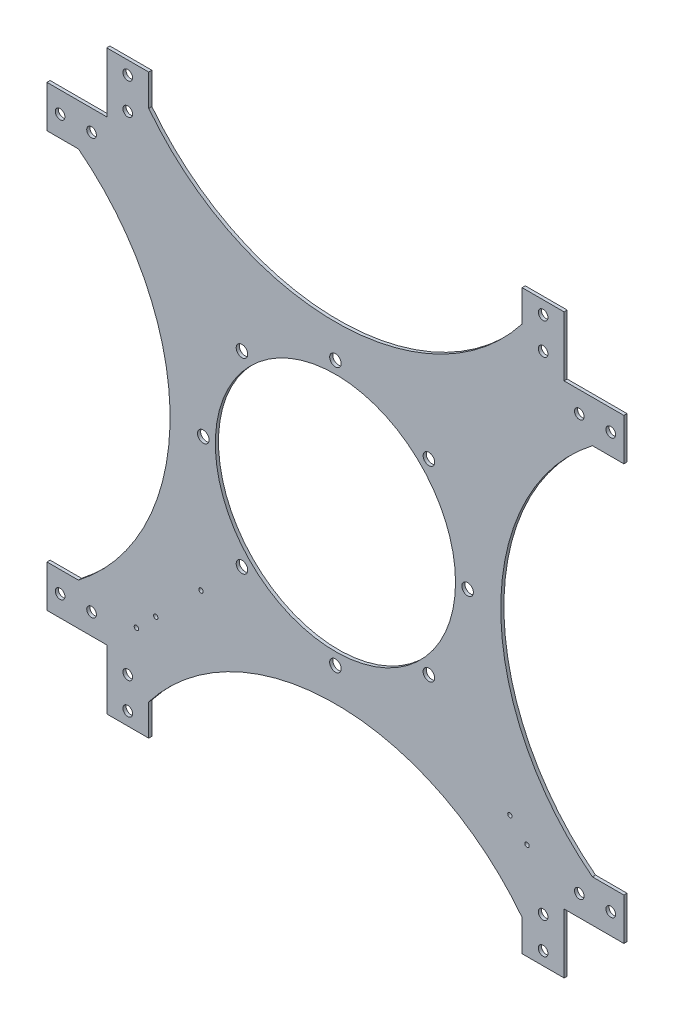
from build123d import *

# Parameters (mm, degrees)
SKETCH1_R          = 114.5
BASE_FLANGE1_DEPTH = 3
SKETCH2_R          = 4.6
EXTRUDE1_DEPTH     = 3
SKETCH3_R          = 5.5
EXTRUDE2_DEPTH     = 3
CIRPATTERN1_COUNT  = 8
SKETCH4_R          = 2.1
CUT_EXTRUDE1_DEPTH = 10


# Sheet-metal steps are written as plain solids
with BuildPart() as part:
    # Sketch1 → Base-Flange1 (new body)
    with BuildSketch(Plane.XY):
        with BuildLine():
            Line((218, 218), (218, 275))
            Line((218, 275), (178, 275))
            Line((178, 275), (178, 245))
            ThreePointArc((178, 245), (0, 157.626305625), (-178, 245))
            Line((-178, 245), (-178, 275))
            Line((-178, 275), (-218, 275))
            Line((-218, 275), (-218, 218))
            Line((-218, 218), (-275, 218))
            Line((-275, 218), (-275, 178))
            Line((-275, 178), (-245, 178))
            ThreePointArc((-245, 178), (-157.626305625, 0), (-245, -178))
            Line((-245, -178), (-275, -178))
            Line((-275, -178), (-275, -218))
            Line((-275, -218), (-218, -218))
            Line((-218, -218), (-218, -275))
            Line((-218, -275), (-178, -275))
            Line((-178, -275), (-178, -245))
            ThreePointArc((-178, -245), (0, -157.626305625), (178, -245))
            Line((178, -245), (178, -275))
            Line((178, -275), (218, -275))
            Line((218, -275), (218, -218))
            Line((218, -218), (275, -218))
            Line((275, -218), (275, -178))
            Line((275, -178), (245, -178))
            ThreePointArc((245, -178), (157.626305625, 0), (245, 178))
            Line((245, 178), (275, 178))
            Line((275, 178), (275, 218))
            Line((275, 218), (218, 218))
        make_face()
        Circle(SKETCH1_R, mode=Mode.SUBTRACT)
    extrude(amount=BASE_FLANGE1_DEPTH)

    # Sketch2 → Extrude1 (cut)
    with BuildSketch(Plane.XY.offset(3)):
        with Locations((198, 262.5)):
            Circle(SKETCH2_R)
        with Locations((198, 232.5)):
            Circle(SKETCH2_R)
        with Locations((232.5, 198)):
            Circle(SKETCH2_R)
        with Locations((262.5, 198)):
            Circle(SKETCH2_R)
        with Locations(Location((262.5, -198, 0), (0, 0, 180))):
            Circle(SKETCH2_R)
        with Locations(Location((232.5, -198, 0), (0, 0, 180))):
            Circle(SKETCH2_R)
        with Locations(Location((198, -232.5, 0), (0, 0, 180))):
            Circle(SKETCH2_R)
        with Locations(Location((198, -262.5, 0), (0, 0, 180))):
            Circle(SKETCH2_R)
        with Locations((-198, -262.5)):
            Circle(SKETCH2_R)
        with Locations((-198, -232.5)):
            Circle(SKETCH2_R)
        with Locations((-232.5, -198)):
            Circle(SKETCH2_R)
        with Locations((-262.5, -198)):
            Circle(SKETCH2_R)
        with Locations(Location((-262.5, 198, 0), (0, 0, 180))):
            Circle(SKETCH2_R)
        with Locations(Location((-232.5, 198, 0), (0, 0, 180))):
            Circle(SKETCH2_R)
        with Locations(Location((-198, 232.5, 0), (0, 0, 180))):
            Circle(SKETCH2_R)
        with Locations(Location((-198, 262.5, 0), (0, 0, 180))):
            Circle(SKETCH2_R)
    extrude(amount=-EXTRUDE1_DEPTH, mode=Mode.SUBTRACT)

    # Sketch3 → Extrude2 (cut)
    with BuildSketch(Plane.XY.offset(3)):
        with Locations((0, 126)):
            Circle(SKETCH3_R)
    extrude2 = extrude(amount=-EXTRUDE2_DEPTH, mode=Mode.SUBTRACT)

    # CirPattern1: Extrude2 ×8 about axis
    cirpattern1_axis = Axis((0, 0, 0), (0, 0, 1))
    for i in range(1, CIRPATTERN1_COUNT):
        add(extrude2.rotate(cirpattern1_axis, i * 360 / CIRPATTERN1_COUNT), mode=Mode.SUBTRACT)

    # Sketch4 → Cut-Extrude1 (cut)
    with BuildSketch(Plane.XY.offset(3)):
        with Locations((-189.715728753, -189.715728753)):
            Circle(SKETCH4_R)
        with Locations((-171.330952442, -171.330952442)):
            Circle(SKETCH4_R)
        with Locations((-128.197438789, -128.197438789)):
            Circle(SKETCH4_R)
        with Locations((166.381204973, -166.381204973)):
            Circle(SKETCH4_R)
        with Locations((182.644660941, -182.644660941)):
            Circle(SKETCH4_R)
    extrude(amount=-CUT_EXTRUDE1_DEPTH, mode=Mode.SUBTRACT)


solid = part.part
